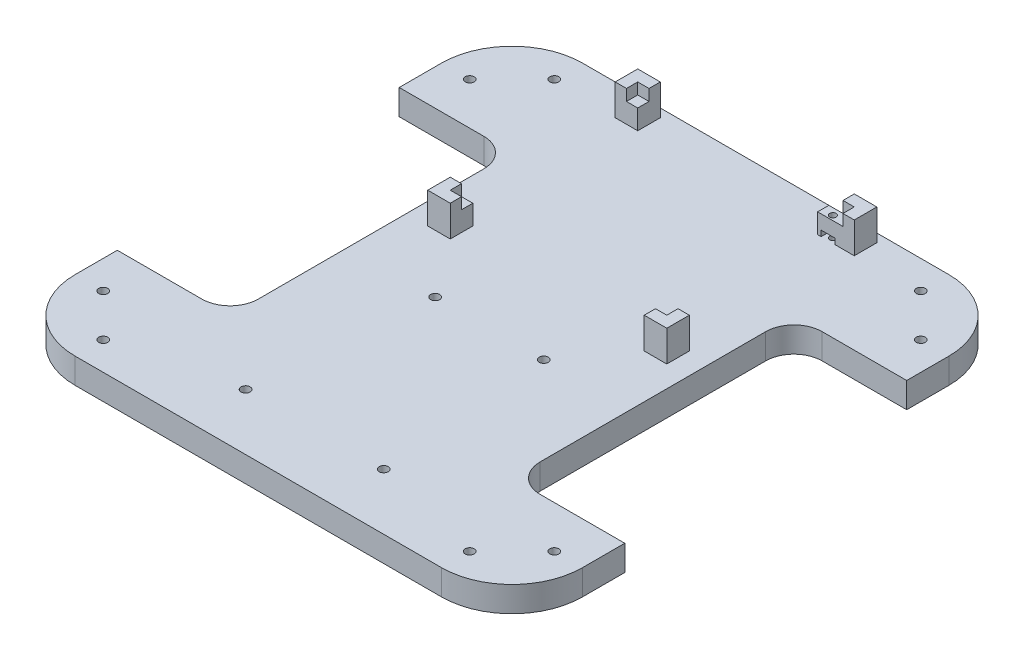
from build123d import *

# Parameters (mm, degrees)
PLATE_DEPTH         = 9
SKETCH3_R           = 1.6
HEX_HOLES_DEPTH     = 128.597021909
SKETCH4_R           = 1.6
ARDUINO_HOLES_DEPTH = 128.597021909
SKETCH5_W           = 40
SKETCH5_H           = 100
CUT_EXTRUDE1_DEPTH  = 128.597021909
FILLET1_R           = 10
BOSS_EXTRUDE1_DEPTH = 11
SKETCH7_W           = 4
SKETCH7_H           = 4
SKETCH7_W_2         = 9
BOSS_EXTRUDE2_DEPTH = 7
SKETCH8_R           = 1.15
CUT_EXTRUDE2_DEPTH  = 129.280941687
SKETCH9_W           = 5
SKETCH9_H           = 2
CUT_EXTRUDE3_DEPTH  = 193.512337267


with BuildPart() as part:
    # Sketch1 → Plate (new body)
    with BuildSketch(Plane(origin=(0, 0, 0), x_dir=(1, 0, 0), z_dir=(0, 1, 0))):
        with BuildLine():
            Line((-65, -90), (65, -90))
            ThreePointArc((65, -90), (82.67766953, -82.67766953), (90, -65))
            Line((90, -65), (90, 65))
            ThreePointArc((90, 65), (82.67766953, 82.67766953), (65, 90))
            Line((65, 90), (-65, 90))
            ThreePointArc((-65, 90), (-82.67766953, 82.67766953), (-90, 65))
            Line((-90, 65), (-90, -65))
            ThreePointArc((-90, -65), (-82.67766953, -82.67766953), (-65, -90))
        make_face()
    extrude(amount=PLATE_DEPTH)

    # Sketch3 → Hex Holes (cut, through all)
    with BuildSketch(Plane(origin=(0, 9, 0), x_dir=(1, 0, 0), z_dir=(0, 1, 0))):
        with Locations((-65, 80)):
            Circle(SKETCH3_R)
        with Locations((-80, 65)):
            Circle(SKETCH3_R)
        with Locations((80, 65)):
            Circle(SKETCH3_R)
        with Locations((80, -65)):
            Circle(SKETCH3_R)
        with Locations((65, 80)):
            Circle(SKETCH3_R)
        with Locations((65, -80)):
            Circle(SKETCH3_R)
        with Locations((-65, -80)):
            Circle(SKETCH3_R)
        with Locations((-80, -65)):
            Circle(SKETCH3_R)
    extrude(amount=-HEX_HOLES_DEPTH, mode=Mode.SUBTRACT)

    # Sketch4 → Arduino Holes (cut, through all)
    with BuildSketch(Plane(origin=(0, 9, 0), x_dir=(1, 0, 0), z_dir=(0, 1, 0))):
        with Locations((-24.5, -70)):
            Circle(SKETCH4_R)
        with Locations((24.5, -70)):
            Circle(SKETCH4_R)
        with Locations((-19.25, -8)):
            Circle(SKETCH4_R)
        with Locations((19.25, -8)):
            Circle(SKETCH4_R)
    extrude(amount=-ARDUINO_HOLES_DEPTH, mode=Mode.SUBTRACT)

    # Sketch5 → Cut-Extrude1 (cut, through all)
    with BuildSketch(Plane(origin=(0, 9, 0), x_dir=(1, 0, 0), z_dir=(0, 1, 0))):
        with Locations((-70, 0)):
            Rectangle(SKETCH5_W, SKETCH5_H)
        with Locations((70, 0)):
            Rectangle(SKETCH5_W, SKETCH5_H)
    extrude(amount=-CUT_EXTRUDE1_DEPTH, mode=Mode.SUBTRACT)

    # Fillet1
    fillet1_edges = [part.edges().sort_by_distance(p)[0] for p in [
        (50, 4.5, -50),
        (50, 4.5, 50),
        (-50, 4.5, -50),
        (-50, 4.5, 50),
    ]]
    fillet(fillet1_edges, radius=FILLET1_R)

    # Sketch6 → Boss-Extrude1 (add)
    with BuildSketch(Plane(origin=(0, 9, 0), x_dir=(1, 0, 0), z_dir=(0, 1, 0))):
        Polygon((34.4, 83), (38.4, 83), (38.4, 79), (42.4, 79), (42.4, 87), (34.4, 87), align=None)
        Polygon((38.4, 20.5), (38.4, 16.5), (34.4, 16.5), (34.4, 12.5), (42.4, 12.5), (42.4, 20.5), align=None)
        Polygon((-38.4, 16.5), (-34.4, 16.5), (-34.4, 12.5), (-42.4, 12.5), (-42.4, 20.5), (-38.4, 20.5), align=None)
        Polygon((-38.4, 83), (-34.4, 83), (-34.4, 87), (-42.4, 87), (-42.4, 79), (-38.4, 79), align=None)
    extrude(amount=BOSS_EXTRUDE1_DEPTH)

    # Sketch7 → Boss-Extrude2 (add)
    with BuildSketch(Plane(origin=(0, 9, 0), x_dir=(1, 0, 0), z_dir=(0, 1, 0))):
        with Locations((-36.4, 18.5)):
            Rectangle(SKETCH7_W, SKETCH7_H)
        with Locations((36.4, 18.5)):
            Rectangle(SKETCH7_W, SKETCH7_H)
        with Locations((-36.4, 81)):
            Rectangle(SKETCH7_W, SKETCH7_H)
        with Locations((33.9, 81)):
            Rectangle(SKETCH7_W_2, SKETCH7_H)
    extrude(amount=BOSS_EXTRUDE2_DEPTH)

    # Sketch8 → Cut-Extrude2 (cut, through all)
    with BuildSketch(Plane(origin=(0, 16, 0), x_dir=(1, 0, 0), z_dir=(0, 1, 0))):
        with Locations((33.15, 80.65)):
            Circle(SKETCH8_R)
    extrude(amount=-CUT_EXTRUDE2_DEPTH, mode=Mode.SUBTRACT)

    # Sketch9 → Cut-Extrude3 (cut, through all)
    with BuildSketch(Plane.XY.offset(-79)):
        with Locations((33.15, 10)):
            Rectangle(SKETCH9_W, SKETCH9_H)
    extrude(amount=-CUT_EXTRUDE3_DEPTH, mode=Mode.SUBTRACT)


solid = part.part
